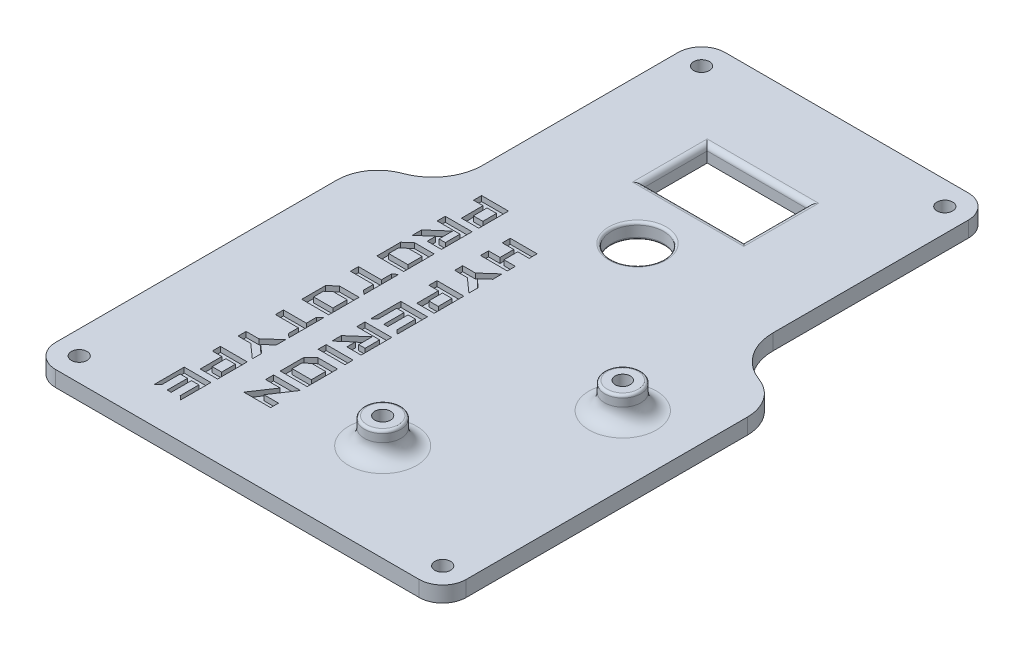
from build123d import *

# Parameters (mm, degrees)
SKETCH1_W           = 78.5
SKETCH1_H           = 116.5
SKETCH1_R           = 1.5
BOSS_EXTRUDE1_DEPTH = 3
CUT_EXTRUDE1_START  = -3
CUT_EXTRUDE1_DEPTH  = 3
SKETCH3_W           = 19.3
SKETCH3_H           = 12.3
CUT_EXTRUDE2_DEPTH  = 71.303805018
FILLET1_R           = 1
SKETCH4_R           = 3.45
SKETCH4_R_2         = 1.45
SKETCH4_R_3         = 3.5
SKETCH4_R_4         = 1.5
BOSS_EXTRUDE2_DEPTH = 5
FILLET2_R           = 3
FILLET3_R           = 0.5
SKETCH5_R           = 5
CUT_EXTRUDE3_DEPTH  = 71.417504926
FILLET4_R           = 0.5
SKETCH6_W           = 1.81118464
SKETCH6_H           = 2.616698455
SKETCH6_W_2         = 5.13663737
SKETCH6_H_2         = 1.539720062
SKETCH6_H_3         = 2.616698454
CUT_EXTRUDE4_DEPTH  = 1


# Read off the part's stored shape, not the designer's step: Cut-Extrude1
with BuildPart() as part:
    # Sketch1 → Boss-Extrude1 (new body)
    with BuildSketch(Plane(origin=(0, 0, 0), x_dir=(1, 0, 0), z_dir=(0, 1, 0))):
        Rectangle(SKETCH1_W, SKETCH1_H)
        with Locations(Location((-34.75, -53.75, 0), (0, 0, 270))):
            Circle(SKETCH1_R, mode=Mode.SUBTRACT)
        with Locations(Location((34.75, -53.75, 0), (0, 0, 270))):
            Circle(SKETCH1_R, mode=Mode.SUBTRACT)
        with Locations(Location((23.25, 53.75, 0), (0, 0, 270))):
            Circle(SKETCH1_R, mode=Mode.SUBTRACT)
        with Locations(Location((-23.25, 53.75, 0), (0, 0, 270))):
            Circle(SKETCH1_R, mode=Mode.SUBTRACT)
    extrude(amount=BOSS_EXTRUDE1_DEPTH)

    # Cut-Extrude1 outline → Cut-Extrude1 (cut)
    with BuildSketch(Plane(origin=(0, 3, 0), x_dir=(1, 0, 0), z_dir=(0, 1, 0)).offset(CUT_EXTRUDE1_START)):
        with BuildLine():
            ThreePointArc((-39.25, 0), (-37.825231203, 4.514460237), (-34.067157109, 7.393209349))
            ThreePointArc((-34.067157109, 7.393209349), (-29.486592932, 10.90199995), (-27.75, 16.404492534))
            Line((-27.75, 16.404492534), (-27.75, 53.75))
            ThreePointArc((-27.75, 53.75), (-26.431980515, 56.931980515), (-23.25, 58.25))
            Line((-23.25, 58.25), (-39.25, 58.25))
            Line((-39.25, 58.25), (-39.25, 0))
        make_face()
        with BuildLine():
            ThreePointArc((-34.750000291, -58.25), (-37.931982689, -56.931978342), (-39.25, -53.749994143))
            Line((-39.25, -53.749994143), (-39.25, -58.25))
            Line((-39.25, -58.25), (-34.750000291, -58.25))
        make_face()
        with BuildLine():
            ThreePointArc((39.25, -53.749999219), (37.931980689, -56.931980342), (34.749999709, -58.25))
            Line((34.749999709, -58.25), (39.25, -58.25))
            Line((39.25, -58.25), (39.25, -53.749999219))
        make_face()
        with BuildLine():
            Line((39.25, 58.25), (23.25, 58.25))
            ThreePointArc((23.25, 58.25), (26.431980515, 56.931980515), (27.75, 53.75))
            Line((27.75, 53.75), (27.750009073, 16.404488946))
            ThreePointArc((27.750009073, 16.404488946), (29.486601293, 10.901996136), (34.067165016, 7.393204944))
            ThreePointArc((34.067165016, 7.393204944), (37.825238738, 4.514455345), (39.250006951, -5.076e-06))
            Line((39.250006951, -5.076e-06), (39.25, 58.25))
        make_face()
    extrude(amount=CUT_EXTRUDE1_DEPTH, mode=Mode.SUBTRACT)

    # Sketch3 → Cut-Extrude2 (cut, through all)
    with BuildSketch(Plane(origin=(0, 3, 0), x_dir=(1, 0, 0), z_dir=(0, 1, 0))):
        with Locations((0, 35.077246267)):
            Rectangle(SKETCH3_W, SKETCH3_H)
    extrude(amount=-CUT_EXTRUDE2_DEPTH, mode=Mode.SUBTRACT)

    # Fillet1
    fillet1_edges = [part.edges().sort_by_distance(p)[0] for p in [
        (-9.65, 3, -35.077246267),
        (0, 3, -28.927246267),
        (9.65, 3, -35.077246267),
        (0, 3, -41.227246267),
    ]]
    fillet(fillet1_edges, radius=FILLET1_R)

    # Sketch4 → Boss-Extrude2 (add)
    # profile 1 of 2: a face of its own
    with BuildSketch(Plane(origin=(0, 3, 0), x_dir=(1, 0, 0), z_dir=(0, 1, 0))):
        with Locations(Location((26.25, -10.825002147, 0), (0, 0, 90))):
            Circle(SKETCH4_R)
        with Locations(Location((26.25, -10.825002147, 0), (0, 0, 270))):
            Circle(SKETCH4_R_2, mode=Mode.SUBTRACT)
    # profile 2 of 2: a face of its own
    with BuildSketch(Plane(origin=(0, 3, 0), x_dir=(1, 0, 0), z_dir=(0, 1, 0))):
        with Locations(Location((9.15, -39.625002147, 0), (0, 0, 90))):
            Circle(SKETCH4_R_3)
        with Locations(Location((9.15, -39.625002147, 0), (0, 0, 270))):
            Circle(SKETCH4_R_4, mode=Mode.SUBTRACT)
    extrude(amount=BOSS_EXTRUDE2_DEPTH)

    # Fillet2
    fillet2_edges = [part.edges().sort_by_distance(p)[0] for p in [
        (26.25, 3, 14.275002147),
        (9.15, 3, 43.125002147),
    ]]
    fillet(fillet2_edges, radius=FILLET2_R)

    # Fillet3
    fillet3_edges = [part.edges().sort_by_distance(p)[0] for p in [
        (26.25, 8, 14.275002147),
        (9.15, 8, 43.125002147),
    ]]
    fillet(fillet3_edges, radius=FILLET3_R)

    # Sketch5 → Cut-Extrude3 (cut, through all)
    with BuildSketch(Plane(origin=(0, 3, 0), x_dir=(1, 0, 0), z_dir=(0, 1, 0))):
        with Locations(Location((0, 18.25, 0), (0, 0, 270))):
            Circle(SKETCH5_R)
    extrude(amount=-CUT_EXTRUDE3_DEPTH, mode=Mode.SUBTRACT)

    # Fillet4
    fillet4_edges = [part.edges().sort_by_distance(p)[0] for p in [
        (0, 0, -23.25),
        (0, 3, -23.25),
    ]]
    fillet(fillet4_edges, radius=FILLET4_R)

    # Sketch6 → Cut-Extrude4 (cut)
    # profile 1 of 17: a face of its own
    with BuildSketch(Plane(origin=(0, 3, 0), x_dir=(1, 0, 0), z_dir=(0, 1, 0))):
        Polygon((-7.889692041, 1.249383274), (-13.026329411, 1.249383274), (-13.026329411, 2.787365668), (-10.832275777, 2.787365668), (-10.832275777, 5.425717664), (-13.026329411, 5.425717664), (-13.026329411, 6.941676822), (-7.889692041, 6.941676822), (-7.889692041, 5.425717664), (-10.076464659, 5.425717664), (-10.076464659, 2.787365668), (-7.889692041, 2.787365668), align=None)
    # profile 2 of 17: a face of its own
    with BuildSketch(Plane(origin=(0, 3, 0), x_dir=(1, 0, 0), z_dir=(0, 1, 0))):
        Polygon((-13.032692922, -2.138423785), (-13.032692922, -3.678142811), (-10.613896031, -3.678142811), (-7.901911639, -6.082280327), (-7.901911639, -4.30849594), (-9.485124149, -2.908258445), (-7.901911639, -1.508070656), (-7.901911639, 0.265713731), (-10.613896031, -2.138423785), align=None)
    # profile 3 of 17: a face of its own
    with BuildSketch(Plane(origin=(0, 3, 0), x_dir=(1, 0, 0), z_dir=(0, 1, 0))):
        Polygon((-11.202364936, -8.611076587), (-13.020127447, -8.611076587), (-13.020127447, -7.071842202), (-7.881264661, -7.071842202), (-7.881264661, -12.752350051), (-11.202364936, -12.752350051), align=None)
        with Locations((-9.541814798, -9.904766439)):
            Rectangle(SKETCH6_W, SKETCH6_H, mode=Mode.SUBTRACT)
    # profile 4 of 17: a face of its own
    with BuildSketch(Plane(origin=(0, 3, 0), x_dir=(1, 0, 0), z_dir=(0, 1, 0))):
        Polygon((-12.286162485, -19.054046537), (-13.041120302, -19.713625216), (-13.041120302, -13.967962058), (-7.942768589, -13.967962058), (-7.942768589, -19.728123044), (-8.697726406, -19.076032493), (-8.697726406, -15.506978975), (-10.114437577, -15.506978975), (-10.114437577, -19.383835877), (-10.869450279, -19.383835877), (-10.869450279, -15.506978975), (-12.286162485, -15.506978975), align=None)
    # profile 5 of 17: a face of its own
    with BuildSketch(Plane(origin=(0, 3, 0), x_dir=(1, 0, 0), z_dir=(0, 1, 0))):
        Polygon((-13.062605048, -27.13187813), (-13.062605048, -25.321445306), (-9.910839402, -22.5581531), (-9.910839402, -25.152862492), (-8.697726406, -25.152862492), (-8.697726406, -22.363036155), (-13.062605048, -22.363036155), (-13.062605048, -20.809142395), (-7.942768589, -20.809142395), (-7.942768589, -26.662778127), (-10.66579722, -26.662778127), (-10.66579722, -25.035587491), align=None)
    # profile 6 of 17: a face of its own
    with BuildSketch(Plane(origin=(0, 3, 0), x_dir=(1, 0, 0), z_dir=(0, 1, 0))):
        with Locations((-10.458010726, -29.023275834)):
            Rectangle(SKETCH6_W_2, SKETCH6_H_2)
    # profile 7 of 17: a face of its own
    with BuildSketch(Plane(origin=(0, 3, 0), x_dir=(1, 0, 0), z_dir=(0, 1, 0))):
        Polygon((-13.032691886, -37.034480069), (-7.883329566, -37.034480069), (-7.883329566, -31.21917763), (-11.625466438, -31.21917763), (-13.032691886, -32.471562135), align=None)
        Polygon((-8.621377738, -35.494760007), (-12.29464475, -35.494760007), (-12.29464475, -33.624722471), (-11.290877282, -32.758897692), (-8.621377738, -32.758897692), align=None, mode=Mode.SUBTRACT)
    # profile 8 of 17: a face of its own
    with BuildSketch(Plane(origin=(0, 3, 0), x_dir=(1, 0, 0), z_dir=(0, 1, 0))):
        Polygon((-13.026329411, -44.010721136), (-10.230562071, -39.839727124), (-13.026329411, -39.839727124), (-13.026329411, -38.318427588), (-7.889692041, -38.318427588), (-10.663502421, -42.511099994), (-7.889692041, -42.511099994), (-7.889692041, -44.010721136), align=None)
    # profile 9 of 17: a face of its own
    with BuildSketch(Plane(origin=(0, 3, 0), x_dir=(1, 0, 0), z_dir=(0, 1, 0))):
        Polygon((-21.024997374, 9.739998886), (-22.842759886, 9.739998886), (-22.842759886, 11.279233271), (-17.7038971, 11.279233271), (-17.7038971, 5.598725422), (-21.024997374, 5.598725422), align=None)
        with Locations((-19.364447237, 8.446309034)):
            Rectangle(SKETCH6_W, SKETCH6_H_3, mode=Mode.SUBTRACT)
    # profile 10 of 17: a face of its own
    with BuildSketch(Plane(origin=(0, 3, 0), x_dir=(1, 0, 0), z_dir=(0, 1, 0))):
        Polygon((-22.885237486, -1.946655838), (-22.885237486, -0.136223014), (-19.733471841, 2.627069192), (-19.733471841, 0.0323598), (-18.520358845, 0.0323598), (-18.520358845, 2.822186137), (-22.885237486, 2.822186137), (-22.885237486, 4.376079897), (-17.765401028, 4.376079897), (-17.765401028, -1.477555835), (-20.488429658, -1.477555835), (-20.488429658, 0.149634801), align=None)
    # profile 11 of 17: a face of its own
    with BuildSketch(Plane(origin=(0, 3, 0), x_dir=(1, 0, 0), z_dir=(0, 1, 0))):
        Polygon((-22.855324325, -8.747763143), (-17.705962005, -8.747763143), (-17.705962005, -2.932460704), (-21.448098876, -2.932460704), (-22.855324325, -4.184845209), align=None)
        Polygon((-18.444010177, -7.208043081), (-22.117277188, -7.208043081), (-22.117277188, -5.338005544), (-21.11350972, -4.472180766), (-18.444010177, -4.472180766), align=None, mode=Mode.SUBTRACT)
    # profile 12 of 17: a face of its own
    with BuildSketch(Plane(origin=(0, 3, 0), x_dir=(1, 0, 0), z_dir=(0, 1, 0))):
        Polygon((-18.468192554, -15.683520061), (-18.468192554, -13.788885923), (-22.84896185, -13.788885923), (-22.84896185, -12.260011272), (-18.468192554, -12.260011272), (-18.468192554, -10.343431566), (-17.71232448, -9.692379681), (-17.71232448, -16.33480184), align=None)
    # profile 13 of 17: a face of its own
    with BuildSketch(Plane(origin=(0, 3, 0), x_dir=(1, 0, 0), z_dir=(0, 1, 0))):
        Polygon((-22.855324325, -23.094720816), (-17.705962005, -23.094720816), (-17.705962005, -17.279418377), (-21.448098876, -17.279418377), (-22.855324325, -18.531802882), align=None)
        Polygon((-18.444010177, -21.555000754), (-22.117277188, -21.555000754), (-22.117277188, -19.684963218), (-21.11350972, -18.819138439), (-18.444010177, -18.819138439), align=None, mode=Mode.SUBTRACT)
    # profile 14 of 17: a face of its own
    with BuildSketch(Plane(origin=(0, 3, 0), x_dir=(1, 0, 0), z_dir=(0, 1, 0))):
        Polygon((-18.468192554, -30.030477734), (-18.468192554, -28.135843597), (-22.84896185, -28.135843597), (-22.84896185, -26.606968945), (-18.468192554, -26.606968945), (-18.468192554, -24.690389239), (-17.71232448, -24.039337354), (-17.71232448, -30.681759513), align=None)
    # profile 15 of 17: a face of its own
    with BuildSketch(Plane(origin=(0, 3, 0), x_dir=(1, 0, 0), z_dir=(0, 1, 0))):
        Polygon((-22.855325361, -33.730234555), (-22.855325361, -35.269953582), (-20.43652847, -35.269953582), (-17.724544078, -37.674091097), (-17.724544078, -35.900306711), (-19.307756588, -34.500069215), (-17.724544078, -33.099881426), (-17.724544078, -31.32609704), (-20.43652847, -33.730234555), align=None)
    # profile 16 of 17: a face of its own
    with BuildSketch(Plane(origin=(0, 3, 0), x_dir=(1, 0, 0), z_dir=(0, 1, 0))):
        Polygon((-21.024997374, -40.202887357), (-22.842759886, -40.202887357), (-22.842759886, -38.663652972), (-17.7038971, -38.663652972), (-17.7038971, -44.344160821), (-21.024997374, -44.344160821), align=None)
        with Locations((-19.364447237, -41.496577209)):
            Rectangle(SKETCH6_W, SKETCH6_H_3, mode=Mode.SUBTRACT)
    # profile 17 of 17: a face of its own
    with BuildSketch(Plane(origin=(0, 3, 0), x_dir=(1, 0, 0), z_dir=(0, 1, 0))):
        Polygon((-22.108794923, -50.645857308), (-22.863752741, -51.305435987), (-22.863752741, -45.559772828), (-17.765401028, -45.559772828), (-17.765401028, -51.319933815), (-18.520358845, -50.667843264), (-18.520358845, -47.098789746), (-19.937070015, -47.098789746), (-19.937070015, -50.975646647), (-20.692082717, -50.975646647), (-20.692082717, -47.098789746), (-22.108794923, -47.098789746), align=None)
    extrude(amount=-CUT_EXTRUDE4_DEPTH, mode=Mode.SUBTRACT)


solid = part.part
